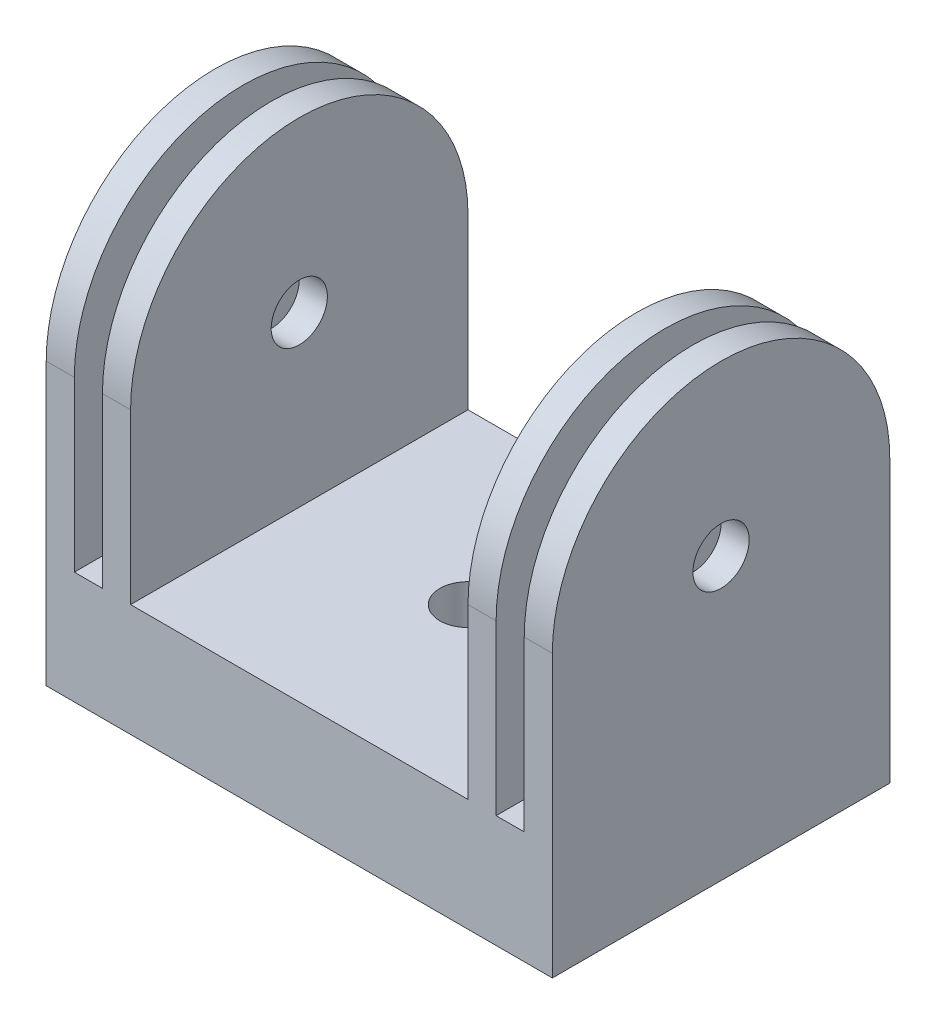
from build123d import *

# Parameters (mm, degrees)
SKETCH1_W               = 45
SKETCH1_H               = 30
BOSS_EXTRUDE1_DEPTH     = 10
SKETCH2_R               = 2.5
BOSS_EXTRUDE2_DEPTH     = 2.5
MIRROR3_COPY_1_SKETCH_R = 2.5
MIRROR3_COPY_1_DEPTH    = 2.5
MIRROR3_COPY_2_SKETCH_R = 2.5
MIRROR3_COPY_2_DEPTH    = 2.5
M6X1_0_TAPPED_HOLE1_D   = 5


with BuildPart() as part:
    # Sketch1 → Boss-Extrude1 (new body)
    with BuildSketch(Plane(origin=(0, 0, 0), x_dir=(1, 0, 0), z_dir=(0, 1, 0))):
        Rectangle(SKETCH1_W, SKETCH1_H)
    extrude(amount=BOSS_EXTRUDE1_DEPTH)

    # Sketch2 → Boss-Extrude2 (add)
    with BuildSketch(Plane(origin=(22.5, 0, 0), x_dir=(0, 0, -1), z_dir=(1, 0, 0))):
        with BuildLine():
            Line((-15, 10), (15, 10))
            Line((15, 10), (15, 25))
            ThreePointArc((15, 25), (0, 40), (-15, 25))
            Line((-15, 25), (-15, 10))
        make_face()
        with Locations((0, 25)):
            Circle(SKETCH2_R, mode=Mode.SUBTRACT)
    boss_extrude2 = extrude(amount=-BOSS_EXTRUDE2_DEPTH)

    # Mirror2: Boss-Extrude2 across plane
    add(boss_extrude2.mirror(Plane(origin=(18.75, 0, 0), x_dir=(0, 0, 1), z_dir=(1, 0, 0))))

    # Mirror3 copy 1 sketch → Mirror3 copy 1 (add)
    with BuildSketch(Plane(origin=(-15, 0, 0), x_dir=(0, 0, -1), z_dir=(1, 0, 0))):
        with BuildLine():
            Line((-15, 10), (15, 10))
            Line((15, 10), (15, 25))
            ThreePointArc((15, 25), (0, 40), (-15, 25))
            Line((-15, 25), (-15, 10))
        make_face()
        with Locations((0, 25)):
            Circle(MIRROR3_COPY_1_SKETCH_R, mode=Mode.SUBTRACT)
    extrude(amount=-MIRROR3_COPY_1_DEPTH)

    # Mirror3 copy 2 sketch → Mirror3 copy 2 (add)
    with BuildSketch(Plane(origin=(-22.5, 0, 0), x_dir=(0, 0, -1), z_dir=(-1, 0, 0))):
        with BuildLine():
            Line((-15, -10), (15, -10))
            Line((15, -10), (15, -25))
            ThreePointArc((15, -25), (0, -40), (-15, -25))
            Line((-15, -25), (-15, -10))
        make_face()
        with Locations((0, -25)):
            Circle(MIRROR3_COPY_2_SKETCH_R, mode=Mode.SUBTRACT)
    extrude(amount=-MIRROR3_COPY_2_DEPTH)

    # M6x1.0 Tapped Hole1 (through all)
    with Locations(Plane(origin=(0, 0, 0), x_dir=(-1, 0, 0), z_dir=(0, -1, 0))):
        with Locations((0, 0)):
            Hole(M6X1_0_TAPPED_HOLE1_D / 2)


solid = part.part
